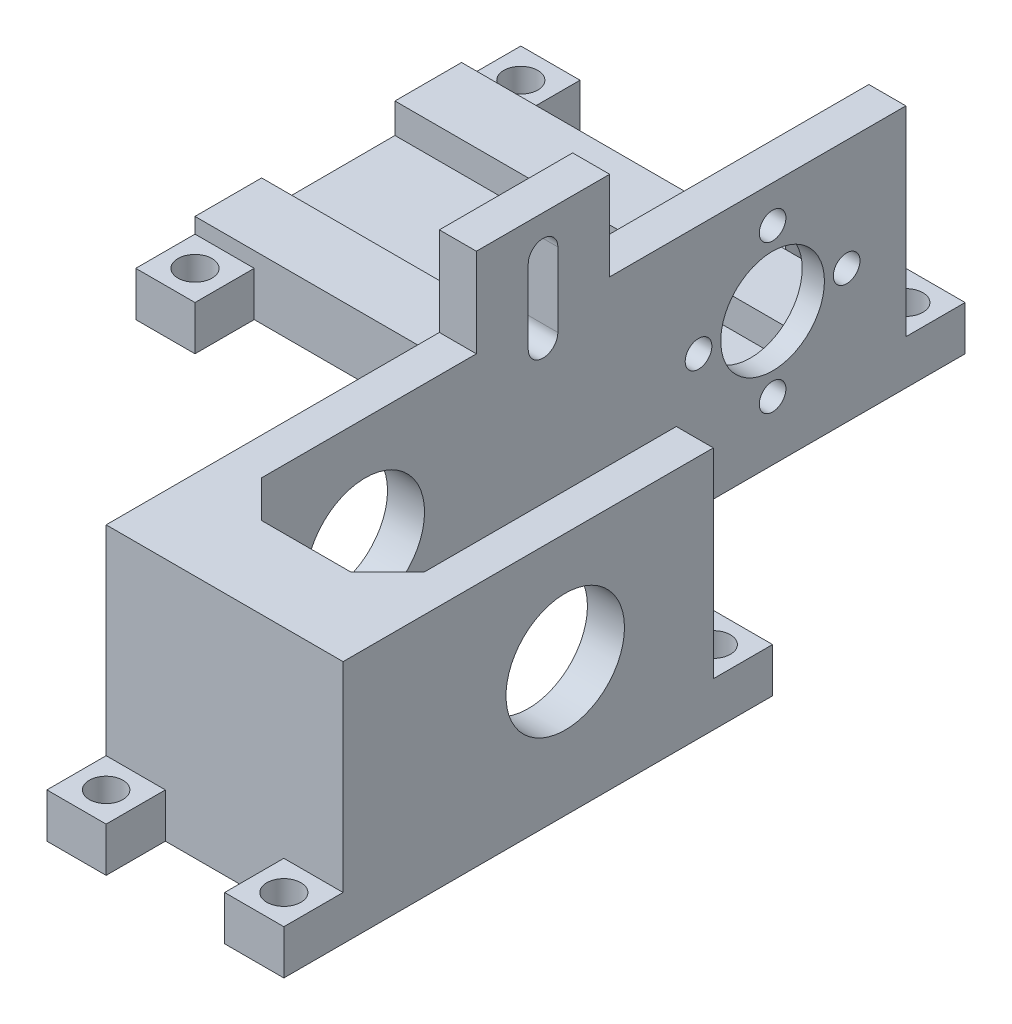
from build123d import *

# Parameters (mm, degrees)
BOSS_EXTRU_1_DEPTH      = 45
ESQUISSE2_R             = 8
ENL_V_MAT_EXTRU_1_DEPTH = 50
ENL_V_MAT_EXTRU_2_DEPTH = 50
ESQUISSE4_R             = 1.8
ESQUISSE4_R_2           = 7
ENL_V_MAT_EXTRU_3_DEPTH = 5
BOSS_EXTRU_2_DEPTH      = 60
BOSS_EXTRU_3_DEPTH      = 45
ESQUISSE11_W            = 8
ESQUISSE11_H            = 8
ESQUISSE11_R            = 2.3
ESQUISSE11_R_2          = 2.268048231
BOSS_EXTRU_6_DEPTH      = 6
ESQUISSE12_W            = 40
ESQUISSE12_H            = 12
ESQUISSE12_W_2          = 45
ENL_V_MAT_EXTRU_5_DEPTH = 50
ESQUISSE13_W            = 5
ESQUISSE13_H            = 12
ENL_V_MAT_EXTRU_6_DEPTH = 20
ESQUISSE25_R            = 13.4
ENL_V_MAT_EXTRU_8_DEPTH = 2


with BuildPart() as part:
    # Esquisse1 → Boss.-Extru.1 (new body)
    with BuildSketch(Plane(origin=(0, 0, 0), x_dir=(1, 0, 0), z_dir=(0, 1, 0))):
        Polygon((-15, 0), (17, 0), (17, 50), (12, 50), (12, 6), (-10, 6), (-10, 103), (-15, 103), align=None)
    extrude(amount=BOSS_EXTRU_1_DEPTH)

    # Esquisse2 → Enlèv. mat.-Extru.1 (cut)
    with BuildSketch(Plane(origin=(17, 0, 0), x_dir=(0, 0, -1), z_dir=(1, 0, 0))):
        with Locations((30, 18)):
            Circle(ESQUISSE2_R)
    extrude(amount=-ENL_V_MAT_EXTRU_1_DEPTH, mode=Mode.SUBTRACT)

    # Esquisse3 → Enlèv. mat.-Extru.2 (cut)
    with BuildSketch(Plane.ZY.offset(15)):
        with BuildLine():
            ThreePointArc((-52, 40), (-54, 42), (-56, 40))
            Line((-56, 40), (-56, 30))
            ThreePointArc((-56, 30), (-54, 28), (-52, 30))
            Line((-52, 30), (-52, 40))
        make_face()
    extrude(amount=-ENL_V_MAT_EXTRU_2_DEPTH, mode=Mode.SUBTRACT)

    # Esquisse4 → Enlèv. mat.-Extru.3 (cut)
    with BuildSketch(Plane(origin=(-10, 0, 0), x_dir=(0, 0, -1), z_dir=(1, 0, 0))):
        with Locations((75, 18)):
            Circle(ESQUISSE4_R)
        with Locations((85, 8)):
            Circle(ESQUISSE4_R)
        with Locations((95, 18)):
            Circle(ESQUISSE4_R)
        with Locations((85, 28)):
            Circle(ESQUISSE4_R)
        with Locations((85, 18)):
            Circle(ESQUISSE4_R_2)
    extrude(amount=-ENL_V_MAT_EXTRU_3_DEPTH, mode=Mode.SUBTRACT)

    # Esquisse4<4> → Boss.-Extru.2 (add)
    with BuildSketch(Plane(origin=(-10, 0, 0), x_dir=(0, 0, -1), z_dir=(1, 0, 0))):
        Polygon((103, 0), (103, 8.072261083), (94, 8.072261083), (94, 4.036130542), (76, 4), (76, 8.072261083), (67, 8.072261083), (67, 0), align=None)
    extrude(amount=-BOSS_EXTRU_2_DEPTH)

    # Esquisse6 → Boss.-Extru.3 (add)
    with BuildSketch(Plane.XZ):
        Polygon((-5, -6), (-10, -6), (-10, -16), (-5, -11), (7, -11), (12, -16), (12, -6), (7, -6), align=None)
    extrude(amount=-BOSS_EXTRU_3_DEPTH)

    # Esquisse11 → Boss.-Extru.6 (add)
    # profile 1 of 7: a face of its own
    with BuildSketch(Plane.XZ):
        with Locations((13, 4)):
            Rectangle(ESQUISSE11_W, ESQUISSE11_H)
        with Locations((13, 4)):
            Circle(ESQUISSE11_R, mode=Mode.SUBTRACT)
    # profile 2 of 7: a face of its own
    with BuildSketch(Plane.XZ):
        with Locations((-11, 4)):
            Rectangle(ESQUISSE11_W, ESQUISSE11_H)
        with Locations((-11, 4)):
            Circle(ESQUISSE11_R_2, mode=Mode.SUBTRACT)
    # profile 3 of 7: a face of its own
    with BuildSketch(Plane.XZ):
        Polygon((17, -58), (17, -50), (12, -50), (12, -46), (9, -46), (9, -58), align=None)
        with Locations((13, -54)):
            Circle(ESQUISSE11_R, mode=Mode.SUBTRACT)
    # profile 4 of 7: a face of its own
    with BuildSketch(Plane.XZ):
        with Locations((-66, -63)):
            Rectangle(ESQUISSE11_W, ESQUISSE11_H)
        with Locations((-66, -63)):
            Circle(ESQUISSE11_R, mode=Mode.SUBTRACT)
    # profile 5 of 7: a face of its own
    with BuildSketch(Plane.XZ):
        with Locations((-66, -107)):
            Rectangle(ESQUISSE11_W, ESQUISSE11_H)
        with Locations((-66, -107)):
            Circle(ESQUISSE11_R, mode=Mode.SUBTRACT)
    # profile 6 of 7: a face of its own
    with BuildSketch(Plane.XZ):
        with Locations((-27, -107)):
            Rectangle(ESQUISSE11_W, ESQUISSE11_H)
        with Locations((-27, -107)):
            Circle(ESQUISSE11_R, mode=Mode.SUBTRACT)
    # profile 7 of 7: a face of its own
    with BuildSketch(Plane.XZ):
        with Locations((-14, -107)):
            Rectangle(ESQUISSE11_W, ESQUISSE11_H)
        with Locations((-14, -107)):
            Circle(ESQUISSE11_R, mode=Mode.SUBTRACT)
    extrude(amount=-BOSS_EXTRU_6_DEPTH)

    # Esquisse12 → Enlèv. mat.-Extru.5 (cut)
    with BuildSketch(Plane.ZY.offset(15)):
        with Locations((-83, 39)):
            Rectangle(ESQUISSE12_W, ESQUISSE12_H)
        with Locations((-22.5, 39)):
            Rectangle(ESQUISSE12_W_2, ESQUISSE12_H)
    extrude(amount=-ENL_V_MAT_EXTRU_5_DEPTH, mode=Mode.SUBTRACT)

    # Esquisse13 → Enlèv. mat.-Extru.6 (cut)
    with BuildSketch(Plane(origin=(17, 0, 0), x_dir=(0, 0, -1), z_dir=(1, 0, 0))):
        with Locations((47.5, 39)):
            Rectangle(ESQUISSE13_W, ESQUISSE13_H)
    extrude(amount=-ENL_V_MAT_EXTRU_6_DEPTH, mode=Mode.SUBTRACT)

    # Esquisse25 → Enlèv. mat.-Extru.8 (cut)
    with BuildSketch(Plane.ZY.offset(15)):
        with Locations((-85, 18)):
            Circle(ESQUISSE25_R)
    extrude(amount=-ENL_V_MAT_EXTRU_8_DEPTH, mode=Mode.SUBTRACT)


solid = part.part
